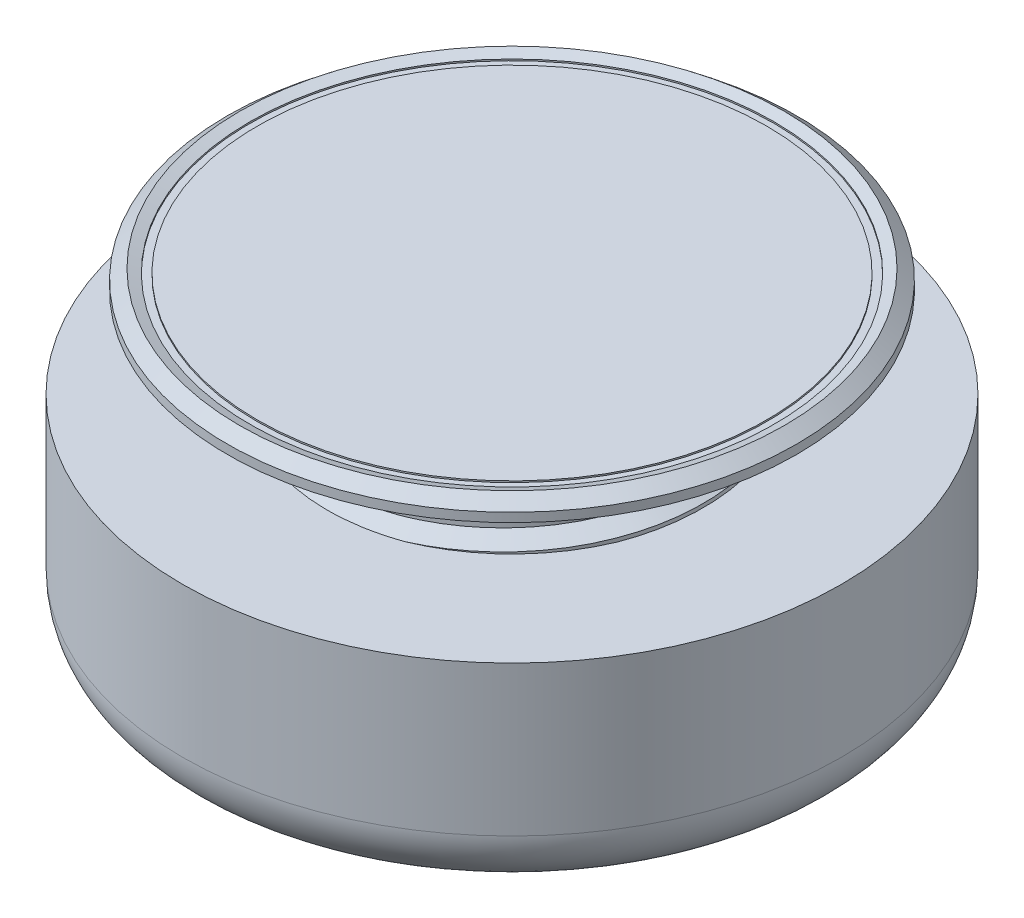
from build123d import *

# Parameters (mm, degrees)
SKETCH_1_R      = 11
EXTRUDE_1_DEPTH = 7
SKETCH_2_R      = 6
EXTRUDE_2_DEPTH = 3
FILLET_1_R      = 2
THREAD_1_PITCH  = 1
SKETCH_9_W      = 0.25
SKETCH_9_H      = 0.05


with BuildPart() as part:
    # Sketch 1 → 凸台-拉伸1 (new body)
    with BuildSketch(Plane(origin=(0, 0, 0), x_dir=(1, 0, 0), z_dir=(0, 1, 0))):
        with Locations(Location((0, 0, 0), (0, 0, 270))):
            Circle(SKETCH_1_R)
    extrude(amount=EXTRUDE_1_DEPTH)

    # 草图2 → 凸台-拉伸2 (add)
    with BuildSketch(Plane(origin=(0, 7, 0), x_dir=(1, 0, 0), z_dir=(0, 1, 0))):
        with Locations(Location((0, 0, 0), (0, 0, 270))):
            Circle(SKETCH_2_R)
    extrude(amount=EXTRUDE_2_DEPTH)

    # 圆角1
    fillet_1_edges = [part.edges().sort_by_distance(p)[0] for p in [
        (0, 0, -11),
    ]]
    fillet(fillet_1_edges, radius=FILLET_1_R)

    # 螺纹线1: the profile of Sketch 1 2 profile screwed along a right-hand helix of 3 turns, 8 arcs to a turn; built about Z, then put on its axis
    thread_1_z = Axis((0, 0, 0), (0, 0, 1))
    thread_1_corners = [(5.9997, 0, -0.000173205), (6.541265875, 0, 0.312499999), (6.541265875, 0, 0.437499999), (5.9997, 0, 0.750173202)]
    with BuildLine(mode=Mode.PRIVATE) as thread_1_profile:
        Line(thread_1_corners[0], thread_1_corners[1])
        Line(thread_1_corners[1], thread_1_corners[2])
        Line(thread_1_corners[2], thread_1_corners[3])
        Line(thread_1_corners[3], thread_1_corners[0])
    thread_1_cap = Face(thread_1_profile.wire())
    thread_1_turn_angles = [0, 22.5, 45, 67.5, 90, 112.5, 135, 157.5, 180, 202.5, 225, 247.5, 270, 292.5, 315, 337.5, 360]
    thread_1_turn_weights = [1, 0.9238795325112867, 1, 0.9238795325112867, 1, 0.9238795325112867, 1, 0.9238795325112867, 1, 0.9238795325112867, 1, 0.9238795325112867, 1, 0.9238795325112867, 1, 0.9238795325112867, 1]
    thread_1_turn_rails = [Edge.make_bspline([Vector(p[0], p[1], 0).rotate(thread_1_z, thread_1_turn_angles[k]) / thread_1_turn_weights[k] + Vector(0, 0, p[2] + THREAD_1_PITCH * thread_1_turn_angles[k] / 360) for k in range(17)], [0, 0, 0, 1, 1, 2, 2, 3, 3, 4, 4, 5, 5, 6, 6, 7, 7, 8, 8, 8], 2, thread_1_turn_weights) for p in thread_1_corners]
    thread_1_turn_sides = [Face.make_surface_from_curves(thread_1_turn_rails[p[0]], thread_1_turn_rails[p[1]]) for p in [(0, 1), (1, 2), (2, 3), (3, 0)]]
    thread_1 = Plane(origin=(0, 10, 0), x_dir=(-1, 0, 0), z_dir=(0, -1, 0)) * Solid(Shell([*[p.moved(Location((0, 0, THREAD_1_PITCH * i))) for i in range(3) for p in thread_1_turn_sides], thread_1_cap, thread_1_cap.rotate(thread_1_z, 1080).moved(Location((0, 0, THREAD_1_PITCH * 1080 / 360)))]))
    add(thread_1)

    # 草图7 → 旋转1 (revolve)
    with BuildSketch(Plane.XY):
        Polygon((0, 10), (-9.5, 10), (-9.5, 10.3), (-9.089054213, 10.632548824), (-8.75, 10.5), (0, 10.5), align=None)
    revolve(axis=Axis((0, 10.5, 0), (0, -1, 0)))

    # 草图9 → 切除-旋转1 (revolve, cut)
    with BuildSketch(Plane.XY, mode=Mode.PRIVATE) as cut_revolve_1_sk:
        with Locations((-8.625, 10.475)):
            Rectangle(SKETCH_9_W, SKETCH_9_H)
    revolve(cut_revolve_1_sk.sketch.rotate(Axis((0, -0.995458227, 0), (0, 1, 0)), 270), axis=Axis((0, -0.995458227, 0), (0, 1, 0)), mode=Mode.SUBTRACT)


solid = part.part
